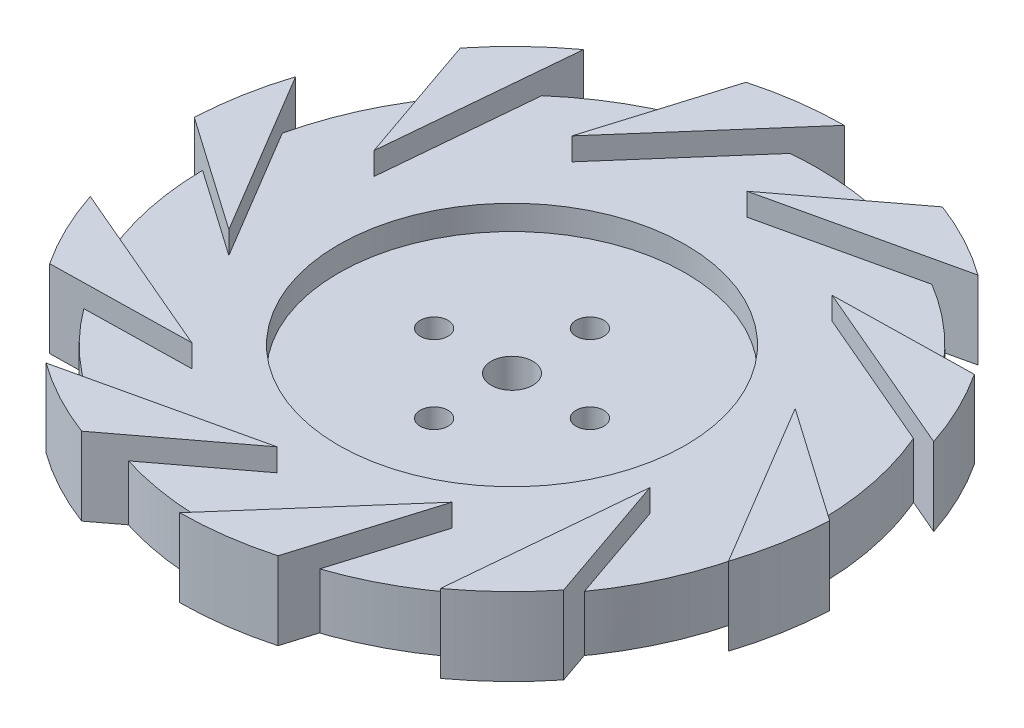
from build123d import *

# Parameters (mm, degrees)
GUIDE_START        = 3.429
GUIDE_VANES_DEPTH  = 17.78
CIRPATTERN4_COUNT  = 10
SKETCH6_R          = 3.175
CUT_EXTRUDE1_DEPTH = 13.97
CIRPATTERN5_COUNT  = 4
SKETCH9_R          = 4.7625
CUT_EXTRUDE2_DEPTH = 7.62


with BuildPart() as part:
    # Sketch3 → Body (revolve)
    with BuildSketch(Plane.XY):
        Polygon((-69.85, 16.0734375), (-39.624, 16.0734375), (-39.624, 10.4854375), (0, 10.4854375), (0, 3.3734375), (-69.85, 3.3734375), align=None)
    revolve(axis=Axis((0, 0, 0), (0, 1, 0)))

    # Sketch4 → Guide Vanes (add)
    with BuildSketch(Plane(origin=(0, 0, 0), x_dir=(1, 0, 0), z_dir=(0, 1, 0)).offset(GUIDE_START)):
        with BuildLine():
            Line((1.553349961, 52.076946284), (26.95018459, 71.275013508))
            ThreePointArc((26.95018459, 71.275013508), (36.029244063, 67.144125374), (44.490941148, 61.862720242))
            Line((44.490941148, 61.862720242), (1.553349961, 52.076946284))
        make_face()
    guide_vanes = extrude(amount=GUIDE_VANES_DEPTH)

    # CirPattern4: Guide Vanes ×10 about axis
    cirpattern4_axis = Axis((0, 16.0734375, 0), (0, -1, 0))
    for i in range(1, CIRPATTERN4_COUNT):
        add(guide_vanes.rotate(cirpattern4_axis, i * 360 / CIRPATTERN4_COUNT))

    # Sketch6 → Cut-Extrude1 (cut)
    with BuildSketch(Plane(origin=(0, 0, 0), x_dir=(1, 0, 0), z_dir=(0, 1, 0))):
        with Locations((0, 17.78)):
            Circle(SKETCH6_R)
    cut_extrude1 = extrude(amount=CUT_EXTRUDE1_DEPTH, mode=Mode.SUBTRACT)

    # CirPattern5: Cut-Extrude1 ×4 about axis
    cirpattern5_axis = Axis((0, 16.0734375, 0), (0, -1, 0))
    for i in range(1, CIRPATTERN5_COUNT):
        add(cut_extrude1.rotate(cirpattern5_axis, i * 360 / CIRPATTERN5_COUNT), mode=Mode.SUBTRACT)

    # Sketch9 → Cut-Extrude2 (cut)
    with BuildSketch(Plane(origin=(0, 10.4854375, 0), x_dir=(1, 0, 0), z_dir=(0, 1, 0))):
        Circle(SKETCH9_R)
    extrude(amount=-CUT_EXTRUDE2_DEPTH, mode=Mode.SUBTRACT)


solid = part.part
